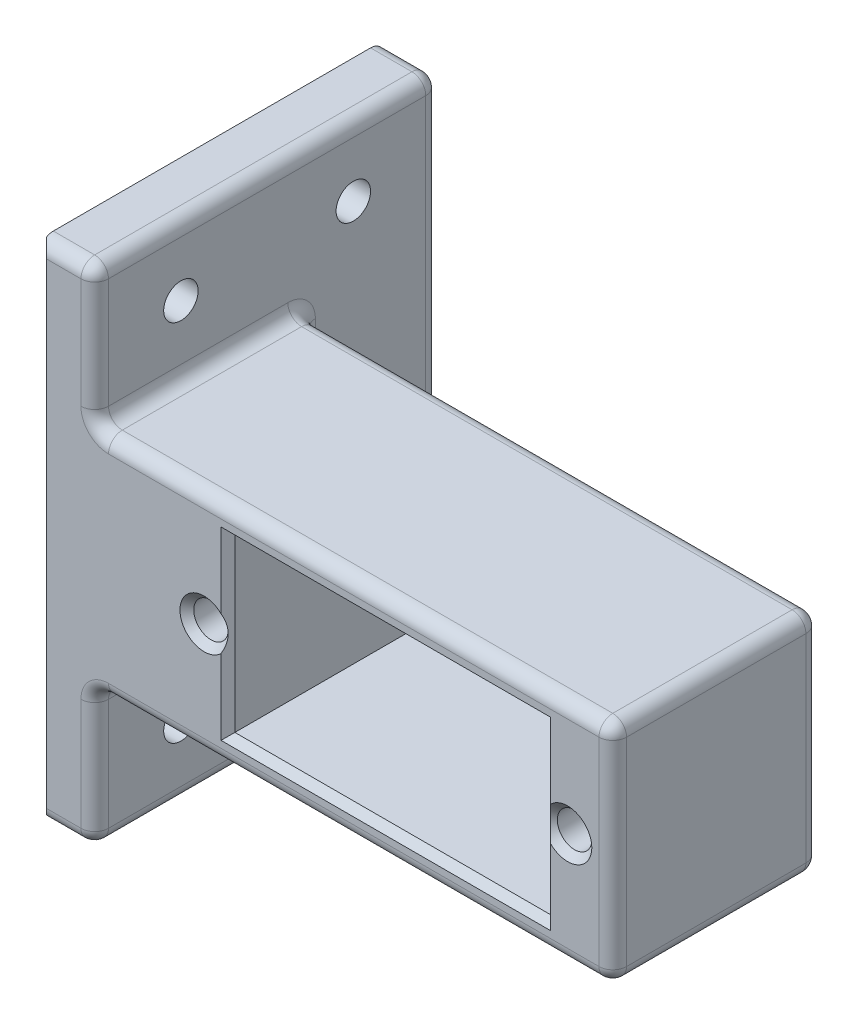
from build123d import *

# Parameters (mm, degrees)
SKETCH1_R           = 1.25
SKETCH1_W           = 22.9
SKETCH1_H           = 12.4
BOSS_EXTRUDE1_DEPTH = 15
SKETCH4_W           = 25
SKETCH4_H           = 36.5
BOSS_EXTRUDE2_DEPTH = 4
SKETCH3_R           = 1.25
CUT_EXTRUDE1_DEPTH  = 35.502452959
CHAMFER1_SIZE       = 0.5
FILLET1_R           = 1


with BuildPart() as part:
    # Sketch1 → Boss-Extrude1 (new body)
    with BuildSketch(Plane.XY):
        Polygon((16.45, -8.2), (16.45, 8.2), (-21.110341698, 8.2), (-21.110341698, 18.2), (-25.110341698, 18.2), (-25.110341698, -18.2), (-21.110341698, -18.2), (-21.110341698, -8.2), align=None)
        with Locations((13.18, 0)):
            Circle(SKETCH1_R, mode=Mode.SUBTRACT)
        with Locations((-13.18, 0)):
            Circle(SKETCH1_R, mode=Mode.SUBTRACT)
        Rectangle(SKETCH1_W, SKETCH1_H, mode=Mode.SUBTRACT)
    extrude(amount=BOSS_EXTRUDE1_DEPTH)

    # Sketch4 → Boss-Extrude2 (add)
    with BuildSketch(Plane.ZY.offset(25.110341698)):
        with Locations((2.5, -0.05)):
            Rectangle(SKETCH4_W, SKETCH4_H)
    extrude(amount=-BOSS_EXTRUDE2_DEPTH)

    # Sketch3 → Cut-Extrude1 (cut, through all)
    with BuildSketch(Plane(origin=(0, 0, 0), x_dir=(0, 0, -1), z_dir=(1, 0, 0))):
        with Locations((-8.75, 13.2)):
            Circle(SKETCH3_R)
        with Locations((3.75, 13.2)):
            Circle(SKETCH3_R)
        with Locations((3.75, -13.2)):
            Circle(SKETCH3_R)
        with Locations((-8.75, -13.2)):
            Circle(SKETCH3_R)
    extrude(amount=-CUT_EXTRUDE1_DEPTH, mode=Mode.SUBTRACT)

    # Chamfer1
    # the kernel refuses this chamfer: 0.5 mm, written as the material it takes off along each edge
    with BuildSketch(Plane(origin=(-25.110341698, 19.485841494, 15), x_dir=(0.9996219169112968, 0, 0.02749587661058555), z_dir=(0, -1, 0))) as chamfer1_piece_1:
        Polygon((CHAMFER1_SIZE * 0.999621916911, -CHAMFER1_SIZE * 0.0274958766106), (-CHAMFER1_SIZE * 0.0274958766106, -CHAMFER1_SIZE * 0.999621916911), (0, 0), align=None)
    extrude(amount=39.071682988, mode=Mode.SUBTRACT)
    with BuildSketch(Plane(origin=(11.45, -6.2, 15), x_dir=(0.9996219169112968, 0, 0.02749587661058574), z_dir=(0, 1, 0)), Plane(origin=(-11.45, 6.2, 15), x_dir=(-0.9996219169112968, 0, 0.027495876610585647), z_dir=(0, -1, 0))) as chamfer1_piece_2:
        Polygon((CHAMFER1_SIZE * 0.999621916911, CHAMFER1_SIZE * 0.0274958766106), (-CHAMFER1_SIZE * 0.0274958766106, CHAMFER1_SIZE * 0.999621916911), (0, 0), align=None)
    extrude(amount=12.4, mode=Mode.SUBTRACT)
    with BuildSketch(Plane(origin=(11.45, 6.2, 15), x_dir=(0, 0.9996219169112968, 0.027495876610585647), z_dir=(-1, 0, 0)), Plane(origin=(-11.45, -6.2, 15), x_dir=(0, -0.9996219169112968, 0.027495876610585647), z_dir=(1, 0, 0))) as chamfer1_piece_3:
        Polygon((CHAMFER1_SIZE * 0.999621916911, CHAMFER1_SIZE * 0.0274958766106), (-CHAMFER1_SIZE * 0.0274958766106, CHAMFER1_SIZE * 0.999621916911), (0, 0), align=None)
    extrude(amount=22.9, mode=Mode.SUBTRACT)
    with BuildSketch(Plane(origin=(13.18, 0, 15), x_dir=(1, 0, 0), z_dir=(0, -1, 0))) as chamfer1_piece_4:
        Polygon((1.25 + CHAMFER1_SIZE, 0), (1.25, -CHAMFER1_SIZE), (1.25, 0), align=None)
    revolve(axis=Axis((13.18, 0, 15), (0, 0, 1)), mode=Mode.SUBTRACT)
    with BuildSketch(Plane(origin=(-13.18, 0, 15), x_dir=(1, 0, 0), z_dir=(0, -1, 0))) as chamfer1_piece_5:
        Polygon((1.25 + CHAMFER1_SIZE, 0), (1.25, -CHAMFER1_SIZE), (1.25, 0), align=None)
    revolve(axis=Axis((-13.18, 0, 15), (0, 0, 1)), mode=Mode.SUBTRACT)
    with BuildSketch(Plane(origin=(11.45, -7.485841494, 15), x_dir=(0.9996219169112968, 0, 0.027495876610585647), z_dir=(0, 1, 0))) as chamfer1_piece_6a_section:
        Polygon((CHAMFER1_SIZE * 0.999621916911, CHAMFER1_SIZE * 0.0274958766106), (-CHAMFER1_SIZE * 0.0274958766106, CHAMFER1_SIZE * 0.999621916911), (0, 0), align=None)
    chamfer1_piece_6a = extrude(amount=13.685841494, mode=Mode.PRIVATE)
    chamfer1_piece_6a = split(chamfer1_piece_6a, bisect_by=Plane(origin=(11.614896813, -6.2, 14.835103187), z_dir=(0, -1, 0)), keep=Keep.TOP, mode=Mode.PRIVATE)
    with BuildSketch(Plane(origin=(-11.45, -6.2, 15), x_dir=(0, -0.9996219169112968, 0.027495876610585647), z_dir=(1, 0, 0))) as chamfer1_piece_6b_section:
        Polygon((CHAMFER1_SIZE * 0.999621916911, CHAMFER1_SIZE * 0.0274958766106), (-CHAMFER1_SIZE * 0.0274958766106, CHAMFER1_SIZE * 0.999621916911), (0, 0), align=None)
    chamfer1_piece_6b = extrude(amount=24.185841494, mode=Mode.PRIVATE)
    chamfer1_piece_6b = split(chamfer1_piece_6b, bisect_by=Plane(origin=(11.45, -6.364896813, 14.835103187), z_dir=(1, 0, 0)), keep=Keep.TOP, mode=Mode.PRIVATE)
    chamfer1_piece_6 = chamfer1_piece_6a & chamfer1_piece_6b
    add(chamfer1_piece_6, mode=Mode.SUBTRACT)
    with BuildSketch(Plane(origin=(11.45, -6.2, 15), x_dir=(0.9996219169112968, 0, 0.02749587661058574), z_dir=(0, 1, 0))) as chamfer1_piece_7a_section:
        Polygon((CHAMFER1_SIZE * 0.999621916911, CHAMFER1_SIZE * 0.0274958766106), (-CHAMFER1_SIZE * 0.0274958766106, CHAMFER1_SIZE * 0.999621916911), (0, 0), align=None)
    chamfer1_piece_7a = extrude(amount=13.685841494, mode=Mode.PRIVATE)
    chamfer1_piece_7a = split(chamfer1_piece_7a, bisect_by=Plane(origin=(11.614896813, 6.2, 14.835103187), z_dir=(0, 1, 0)), keep=Keep.TOP, mode=Mode.PRIVATE)
    with BuildSketch(Plane(origin=(12.735841494, 6.2, 15), x_dir=(0, 0.9996219169112968, 0.027495876610585647), z_dir=(-1, 0, 0))) as chamfer1_piece_7b_section:
        Polygon((CHAMFER1_SIZE * 0.999621916911, CHAMFER1_SIZE * 0.0274958766106), (-CHAMFER1_SIZE * 0.0274958766106, CHAMFER1_SIZE * 0.999621916911), (0, 0), align=None)
    chamfer1_piece_7b = extrude(amount=24.185841494, mode=Mode.PRIVATE)
    chamfer1_piece_7b = split(chamfer1_piece_7b, bisect_by=Plane(origin=(11.45, 6.364896813, 14.835103187), z_dir=(1, 0, 0)), keep=Keep.TOP, mode=Mode.PRIVATE)
    chamfer1_piece_7 = chamfer1_piece_7a & chamfer1_piece_7b
    add(chamfer1_piece_7, mode=Mode.SUBTRACT)
    with BuildSketch(Plane(origin=(-11.45, 7.485841494, 15), x_dir=(-0.9996219169112968, 0, 0.027495876610585647), z_dir=(0, -1, 0))) as chamfer1_piece_8a_section:
        Polygon((CHAMFER1_SIZE * 0.999621916911, CHAMFER1_SIZE * 0.0274958766106), (-CHAMFER1_SIZE * 0.0274958766106, CHAMFER1_SIZE * 0.999621916911), (0, 0), align=None)
    chamfer1_piece_8a = extrude(amount=13.685841494, mode=Mode.PRIVATE)
    chamfer1_piece_8a = split(chamfer1_piece_8a, bisect_by=Plane(origin=(-11.614896813, 6.2, 14.835103187), z_dir=(0, 1, 0)), keep=Keep.TOP, mode=Mode.PRIVATE)
    with BuildSketch(Plane(origin=(11.45, 6.2, 15), x_dir=(0, 0.9996219169112968, 0.027495876610585647), z_dir=(-1, 0, 0))) as chamfer1_piece_8b_section:
        Polygon((CHAMFER1_SIZE * 0.999621916911, CHAMFER1_SIZE * 0.0274958766106), (-CHAMFER1_SIZE * 0.0274958766106, CHAMFER1_SIZE * 0.999621916911), (0, 0), align=None)
    chamfer1_piece_8b = extrude(amount=24.185841494, mode=Mode.PRIVATE)
    chamfer1_piece_8b = split(chamfer1_piece_8b, bisect_by=Plane(origin=(-11.45, 6.364896813, 14.835103187), z_dir=(-1, 0, 0)), keep=Keep.TOP, mode=Mode.PRIVATE)
    chamfer1_piece_8 = chamfer1_piece_8a & chamfer1_piece_8b
    add(chamfer1_piece_8, mode=Mode.SUBTRACT)
    with BuildSketch(Plane(origin=(-12.735841494, -6.2, 15), x_dir=(0, -0.9996219169112968, 0.027495876610585647), z_dir=(1, 0, 0))) as chamfer1_piece_9a_section:
        Polygon((CHAMFER1_SIZE * 0.999621916911, CHAMFER1_SIZE * 0.0274958766106), (-CHAMFER1_SIZE * 0.0274958766106, CHAMFER1_SIZE * 0.999621916911), (0, 0), align=None)
    chamfer1_piece_9a = extrude(amount=24.185841494, mode=Mode.PRIVATE)
    chamfer1_piece_9a = split(chamfer1_piece_9a, bisect_by=Plane(origin=(-11.45, -6.364896813, 14.835103187), z_dir=(-1, 0, 0)), keep=Keep.TOP, mode=Mode.PRIVATE)
    with BuildSketch(Plane(origin=(-11.45, 6.2, 15), x_dir=(-0.9996219169112968, 0, 0.027495876610585647), z_dir=(0, -1, 0))) as chamfer1_piece_9b_section:
        Polygon((CHAMFER1_SIZE * 0.999621916911, CHAMFER1_SIZE * 0.0274958766106), (-CHAMFER1_SIZE * 0.0274958766106, CHAMFER1_SIZE * 0.999621916911), (0, 0), align=None)
    chamfer1_piece_9b = extrude(amount=13.685841494, mode=Mode.PRIVATE)
    chamfer1_piece_9b = split(chamfer1_piece_9b, bisect_by=Plane(origin=(-11.614896813, -6.2, 14.835103187), z_dir=(0, -1, 0)), keep=Keep.TOP, mode=Mode.PRIVATE)
    chamfer1_piece_9 = chamfer1_piece_9a & chamfer1_piece_9b
    add(chamfer1_piece_9, mode=Mode.SUBTRACT)

    # Fillet1
    fillet1_edges = [part.edges().sort_by_distance(p)[0] for p in [
        (-21.110341698, -13.25, 15),
        (-21.110341698, 0, 0),
        (-21.110341698, 13.2, 15),
        (-21.110341698, -8.2, 7.5),
        (-2.330170849, -8.2, 15),
        (-2.330170849, -8.2, 0),
        (-2.330170849, 8.2, 15),
        (-21.110341698, 8.2, 7.5),
        (-2.330170849, 8.2, 0),
        (16.45, -8.2, 7.5),
        (16.45, 0, 15),
        (16.45, 8.2, 7.5),
        (16.45, 0, 0),
        (-21.110341698, 18.2, 2.5),
        (-22.860341698, 18.2, 15),
        (-23.110341698, -18.3, -10),
        (-23.110341698, 18.2, -10),
        (-21.110341698, -0.05, -10),
        (-22.860341698, -18.3, 15),
        (-21.110341698, -18.3, 2.5),
    ]]
    fillet(fillet1_edges, radius=FILLET1_R)


solid = part.part
